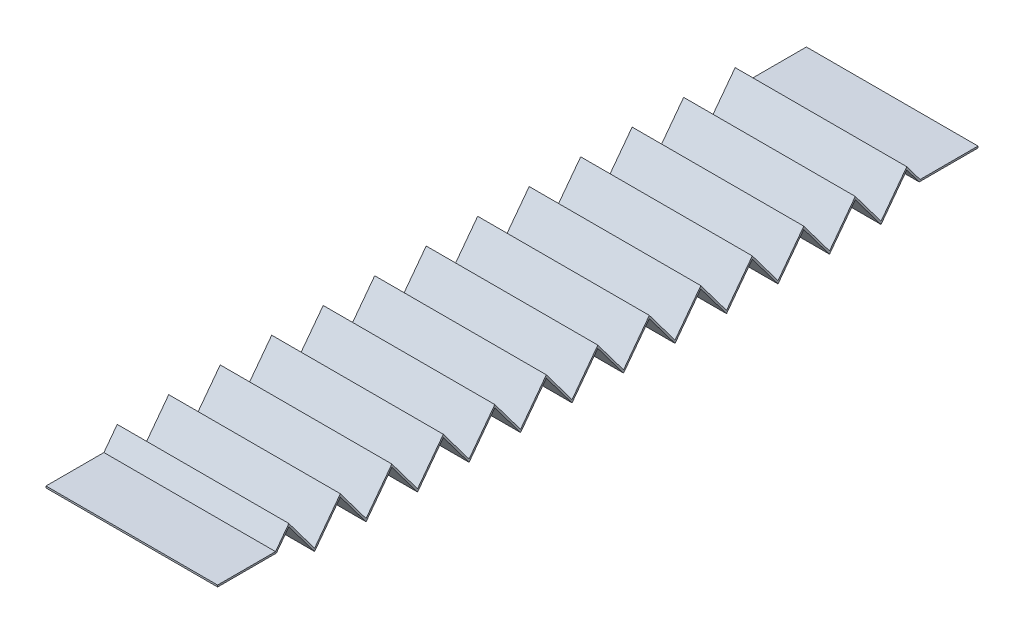
from build123d import *

# Parameters (mm, degrees)
EXTRUDE_THIN1_DEPTH = 25


with BuildPart() as part:
    # Sketch3 → Extrude-Thin1 (new, symmetric)
    with BuildSketch(Plane(origin=(0, 0, 0), x_dir=(0, 0, -1), z_dir=(1, 0, 0))):
        Polygon((0, 4.75), (17.124987671, 4.75), (20.750616503, 9.583377165), (28.251849509, -0.416622835), (35.753082515, 9.583377165), (43.254315521, -0.416622835), (50.755548526, 9.583377165), (58.256781532, -0.416622835), (65.758014538, 9.583377165), (73.259247544, -0.416622835), (80.76048055, 9.583377165), (88.261713556, -0.416622835), (95.762946562, 9.583377165), (103.264179568, -0.416622835), (110.765412573, 9.583377165), (118.266645579, -0.416622835), (125.767878585, 9.583377165), (133.269111591, -0.416622835), (140.770344597, 9.583377165), (148.271577603, -0.416622835), (155.772810609, 9.583377165), (163.274043615, -0.416622835), (170.77527662, 9.583377165), (178.276509626, -0.416622835), (185.777742632, 9.583377165), (193.278975638, -0.416622835), (200.780208644, 9.583377165), (204.405837476, 4.75), (221.530825147, 4.75), (221.530825147, 5.25), (204.655812818, 5.25), (200.780208644, 10.416622835), (193.278975638, 0.416622835), (185.777742632, 10.416622835), (178.276509626, 0.416622835), (170.77527662, 10.416622835), (163.274043615, 0.416622835), (155.772810609, 10.416622835), (148.271577603, 0.416622835), (140.770344597, 10.416622835), (133.269111591, 0.416622835), (125.767878585, 10.416622835), (118.266645579, 0.416622835), (110.765412573, 10.416622835), (103.264179568, 0.416622835), (95.762946562, 10.416622835), (88.261713556, 0.416622835), (80.76048055, 10.416622835), (73.259247544, 0.416622835), (65.758014538, 10.416622835), (58.256781532, 0.416622835), (50.755548526, 10.416622835), (43.254315521, 0.416622835), (35.753082515, 10.416622835), (28.251849509, 0.416622835), (20.750616503, 10.416622835), (16.875012329, 5.25), (0, 5.25), align=None)
    extrude(amount=EXTRUDE_THIN1_DEPTH, both=True)


solid = part.part
